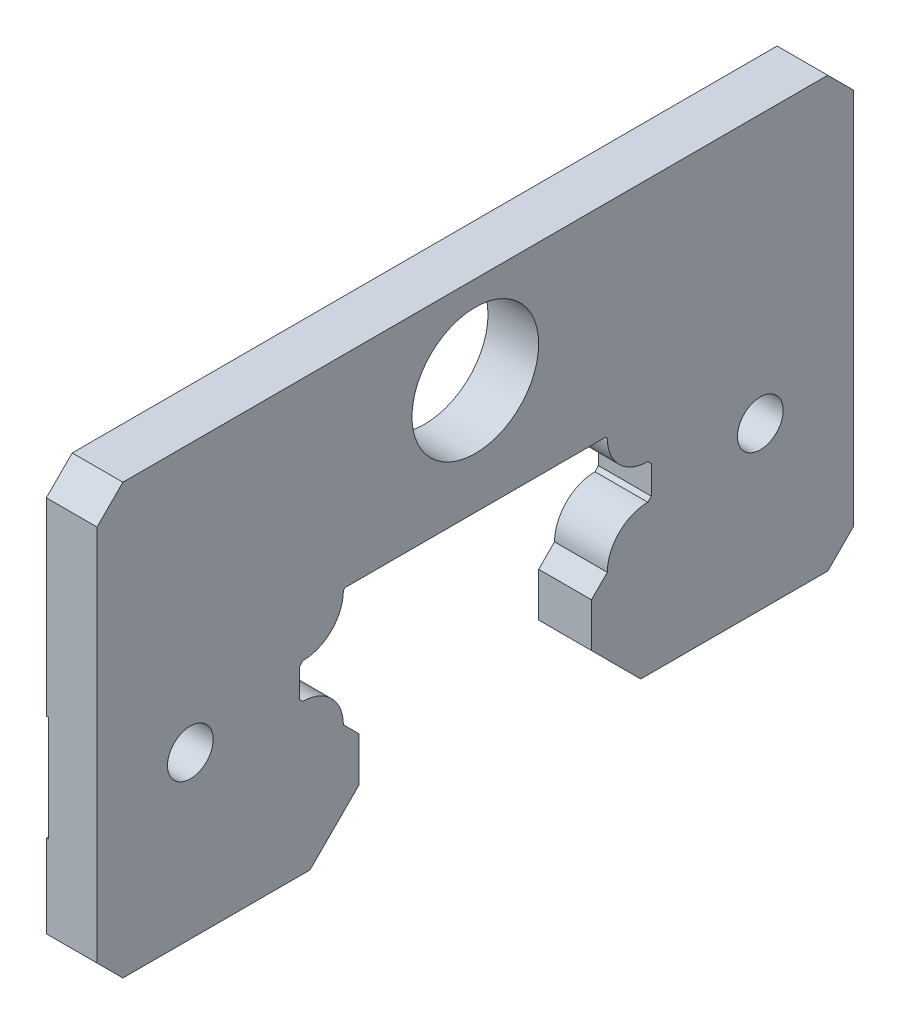
from build123d import *

# Parameters (mm, degrees)
EXTRUDE_1_DEPTH          = 1.5
EXTRUDE_1_DEPTH_BACK     = 1.5
CUT_EXTRUDE_1_DEPTH      = 1.5
CUT_EXTRUDE_1_DEPTH_BACK = 1.5
CUT_EXTRUDE_2_DEPTH      = 0.12
SKETCH_4_R               = 3.6
CUT_EXTRUDE_3_DEPTH      = 3
CUT_EXTRUDE_4_DEPTH      = 0.24
CUT_EXTRUDE_5_DEPTH      = 0.24
CUT_EXTRUDE_6_DEPTH      = 3
CUT_EXTRUDE_6_DEPTH_BACK = 3
SKETCH_7_R               = 1.3
CUT_EXTRUDE_7_DEPTH      = 3
CUT_EXTRUDE_7_DEPTH_BACK = 3
SKETCH_8_R               = 1.3


with BuildPart() as part:
    # Эскиз1 → Бобышка-Вытянуть1 (new, two sides: drawn at the far end of the back side and taken through both)
    with BuildSketch(Plane(origin=(0, 0, 0), x_dir=(0, 0, -1), z_dir=(1, 0, 0)).offset(-EXTRUDE_1_DEPTH_BACK)):
        Polygon((-21.5, 22.929217895), (-21.5, 1.470782105), (-20.029217895, 0), (20.029217895, 0), (21.5, 1.470782105), (21.5, 22.929217895), (20.029217895, 24.4), (-20.029217895, 24.4), align=None)
    extrude(amount=EXTRUDE_1_DEPTH + EXTRUDE_1_DEPTH_BACK)

    # Эскиз2 → Вырез-Вытянуть1 (cut, two sides: drawn at the far end of the back side and taken through both)
    with BuildSketch(Plane(origin=(0, 0, 0), x_dir=(0, 0, -1), z_dir=(1, 0, 0)).offset(-CUT_EXTRUDE_1_DEPTH_BACK)):
        with BuildLine():
            Line((-14, -4.6), (14, -4.6))
            Line((14, -4.6), (6.6, 2.8))
            Line((6.6, 2.8), (6.6, 5.3))
            Line((6.6, 5.3), (7.5, 6.2))
            ThreePointArc((7.5, 6.2), (8.173654403, 7.826345597), (9.8, 8.5))
            Line((9.8, 8.5), (10, 8.7))
            Line((10, 8.7), (10, 10.3))
            Line((10, 10.3), (9.8, 10.5))
            ThreePointArc((9.8, 10.5), (8.173654403, 11.173654403), (7.5, 12.8))
            Line((7.5, 12.8), (7.4, 12.9))
            Line((7.4, 12.9), (-7.4, 12.9))
            Line((-7.4, 12.9), (-7.5, 12.8))
            ThreePointArc((-7.5, 12.8), (-8.173654403, 11.173654403), (-9.8, 10.5))
            Line((-9.8, 10.5), (-10, 10.3))
            Line((-10, 10.3), (-10, 8.7))
            Line((-10, 8.7), (-9.8, 8.5))
            ThreePointArc((-9.8, 8.5), (-8.173654403, 7.826345597), (-7.5, 6.2))
            Line((-7.5, 6.2), (-6.6, 5.3))
            Line((-6.6, 5.3), (-6.6, 2.8))
            Line((-6.6, 2.8), (-14, -4.6))
        make_face()
    extrude(amount=CUT_EXTRUDE_1_DEPTH + CUT_EXTRUDE_1_DEPTH_BACK, mode=Mode.SUBTRACT)

    # Эскиз3 → Вырез-Вытянуть2 (cut)
    with BuildSketch(Plane(origin=(-1.5, 0, 0), x_dir=(0, 0, -1), z_dir=(1, 0, 0))):
        with BuildLine():
            Line((-21.5, -4.6), (-15.414213562, -4.6))
            Line((-15.414213562, -4.6), (-7.6, 3.214213562))
            Line((-7.6, 3.214213562), (-7.6, 4.885786438))
            Line((-7.6, 4.885786438), (-8.207106781, 5.492893219))
            ThreePointArc((-8.207106781, 5.492893219), (-8.880761184, 7.119238816), (-10.507106781, 7.792893219))
            Line((-10.507106781, 7.792893219), (-11, 8.285786438))
            Line((-11, 8.285786438), (-11, 10.714213562))
            Line((-11, 10.714213562), (-10.507106781, 11.207106781))
            ThreePointArc((-10.507106781, 11.207106781), (-8.880761184, 11.880761184), (-8.207106781, 13.507106781))
            Line((-8.207106781, 13.507106781), (-7.814213562, 13.9))
            Line((-7.814213562, 13.9), (7.814213562, 13.9))
            Line((7.814213562, 13.9), (8.207106781, 13.507106781))
            ThreePointArc((8.207106781, 13.507106781), (8.880761184, 11.880761184), (10.507106781, 11.207106781))
            Line((10.507106781, 11.207106781), (11, 10.714213562))
            Line((11, 10.714213562), (11, 8.285786438))
            Line((11, 8.285786438), (10.507106781, 7.792893219))
            ThreePointArc((10.507106781, 7.792893219), (8.880761184, 7.119238816), (8.207106781, 5.492893219))
            Line((8.207106781, 5.492893219), (7.6, 4.885786438))
            Line((7.6, 4.885786438), (7.6, 3.214213562))
            Line((7.6, 3.214213562), (15.414213562, -4.6))
            Line((15.414213562, -4.6), (21.5, -4.6))
            Line((21.5, -4.6), (21.5, 24.4))
            Line((21.5, 24.4), (-21.5, 24.4))
            Line((-21.5, 24.4), (-21.5, -4.6))
        make_face()
    extrude(amount=CUT_EXTRUDE_2_DEPTH, mode=Mode.SUBTRACT)

    # Эскиз4 → Вырез-Вытянуть3 (cut)
    with BuildSketch(Plane(origin=(-1.5, 0, 0), x_dir=(0, 0, -1), z_dir=(1, 0, 0))):
        with Locations((0, 19.4)):
            Circle(SKETCH_4_R)
    extrude(amount=CUT_EXTRUDE_3_DEPTH, mode=Mode.SUBTRACT)

    # Эскиз5 → Вырез-Вытянуть4 (cut)
    with BuildSketch(Plane(origin=(-1.5, 0, 0), x_dir=(0, 0, -1), z_dir=(1, 0, 0))):
        with BuildLine():
            Line((-21.5, 6.185185), (-16.067934609, 6.185185))
            ThreePointArc((-16.067934609, 6.185185), (-13.195652, 9.312902391), (-16.323369391, 12.185185))
            Line((-16.323369391, 12.185185), (-21.5, 12.185185))
            Line((-21.5, 12.185185), (-21.5, 6.185185))
        make_face()
    extrude(amount=CUT_EXTRUDE_4_DEPTH, mode=Mode.SUBTRACT)

    # Эскиз6 → Вырез-Вытянуть5 (cut)
    with BuildSketch(Plane(origin=(-1.5, 0, 0), x_dir=(0, 0, -1), z_dir=(1, 0, 0))):
        with BuildLine():
            Line((16.067934609, 6.185185), (21.5, 6.185185))
            Line((21.5, 6.185185), (21.5, 12.185185))
            Line((21.5, 12.185185), (16.323369391, 12.185185))
            ThreePointArc((16.323369391, 12.185185), (13.195652, 9.312902391), (16.067934609, 6.185185))
        make_face()
    extrude(amount=CUT_EXTRUDE_5_DEPTH, mode=Mode.SUBTRACT)

    # Эскиз7 → Вырез-Вытянуть6 (cut, two sides: drawn at the far end of the back side and taken through both)
    with BuildSketch(Plane(origin=(0, 0, 0), x_dir=(0, 0, -1), z_dir=(1, 0, 0)).offset(-CUT_EXTRUDE_6_DEPTH_BACK)):
        with Locations((-16.195652, 9.185185)):
            Circle(SKETCH_7_R)
    extrude(amount=CUT_EXTRUDE_6_DEPTH + CUT_EXTRUDE_6_DEPTH_BACK, mode=Mode.SUBTRACT)

    # Эскиз8 → Вырез-Вытянуть7 (cut, two sides: drawn at the far end of the back side and taken through both)
    with BuildSketch(Plane(origin=(0, 0, 0), x_dir=(0, 0, -1), z_dir=(1, 0, 0)).offset(-CUT_EXTRUDE_7_DEPTH_BACK)):
        with Locations((16.195652, 9.185185)):
            Circle(SKETCH_8_R)
    extrude(amount=CUT_EXTRUDE_7_DEPTH + CUT_EXTRUDE_7_DEPTH_BACK, mode=Mode.SUBTRACT)


solid = part.part
